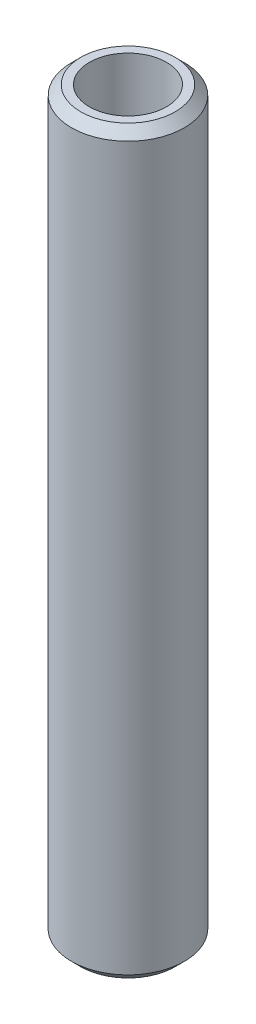
from build123d import *

# Parameters (mm, degrees)
SKETCH1_R           = 22.5
BOSS_EXTRUDE1_DEPTH = 295.145872084
SKETCH2_R           = 15.380858266
CUT_EXTRUDE1_DEPTH  = 297.856170238
CHAMFER1_SIZE       = 3.674580046


with BuildPart() as part:
    # Sketch1 → Boss-Extrude1 (new body)
    with BuildSketch(Plane(origin=(0, 0, 0), x_dir=(1, 0, 0), z_dir=(0, 1, 0))):
        Circle(SKETCH1_R)
    extrude(amount=BOSS_EXTRUDE1_DEPTH)

    # Sketch2 → Cut-Extrude1 (cut, through all)
    with BuildSketch(Plane(origin=(0, 0, 0), x_dir=(1, 0, 0), z_dir=(0, 1, 0))):
        Circle(SKETCH2_R)
    extrude(amount=CUT_EXTRUDE1_DEPTH, mode=Mode.SUBTRACT)

    # Chamfer1
    chamfer1_edges = [part.edges().sort_by_distance(p)[0] for p in [
        (-22.5, 295.145872084, 0),
        (-22.5, 0, 0),
    ]]
    chamfer(chamfer1_edges, length=CHAMFER1_SIZE)


solid = part.part
